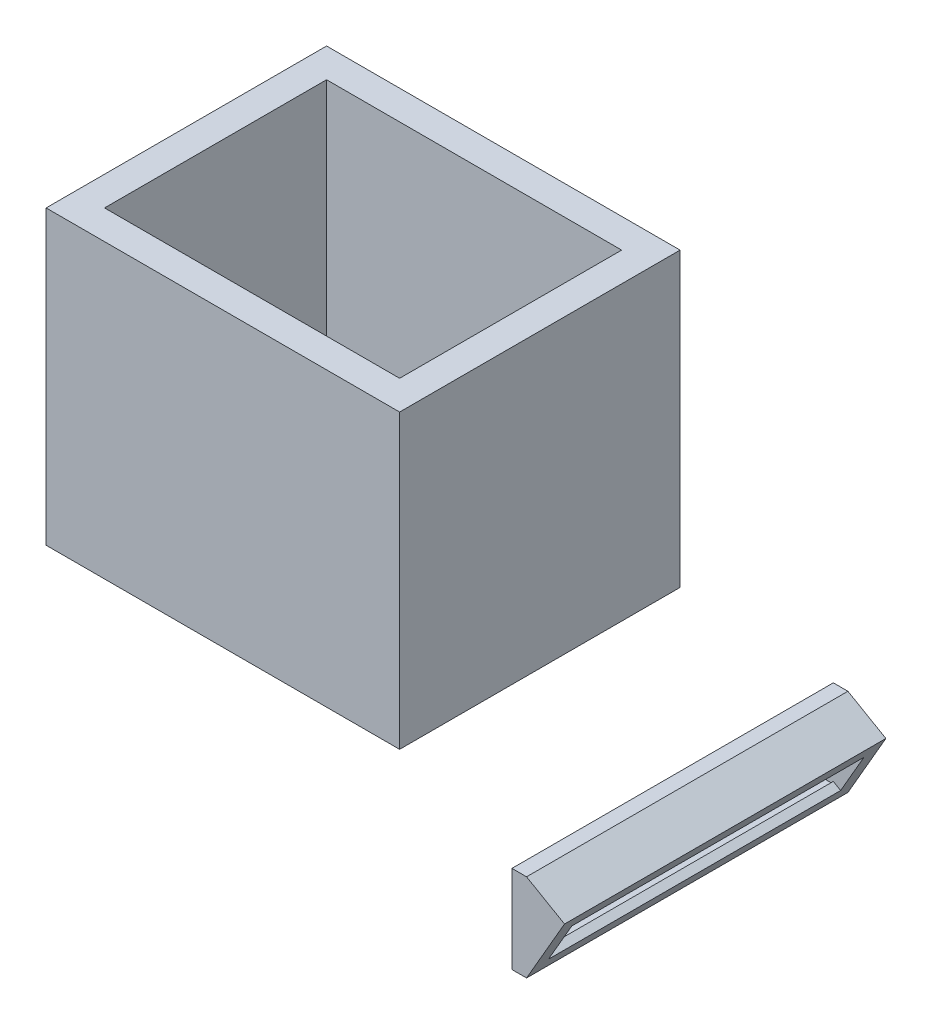
from build123d import *

# Parameters (mm, degrees)
SZKIC1_W                      = 24.2
SZKIC1_H                      = 19.2
SZKIC1_W_2                    = 20.2
SZKIC1_H_2                    = 15.2
DODANIE_WYCI_GNI_CIE1_DEPTH   = 20
SZKIC2_W                      = 22
SZKIC2_H                      = 6
SZKIC2_W_2                    = 20
SZKIC2_H_2                    = 4
DODANIE_WYCI_GNI_CIE2_DEPTH   = 1
DODANIE_WYCI_GNI_CIE3_START   = -29.189963439
DODANIE_WYCI_GNI_CIE3_DEPTH   = 22
DODANIE_WYCI_GNI_CIE3_2_DEPTH = 1
DODANIE_WYCI_GNI_CIE3_START_2 = -8.189963439
DODANIE_WYCI_GNI_CIE3_3_DEPTH = 1


# Read off the part's stored shape, not the designer's step: Dodanie-wyciągnięcie3
with BuildPart() as part:
    # Szkic1 → Dodanie-wyciągnięcie1 (new body)
    with BuildSketch(Plane(origin=(0, 0, 0), x_dir=(1, 0, 0), z_dir=(0, 1, 0))):
        Rectangle(SZKIC1_W, SZKIC1_H)
        Rectangle(SZKIC1_W_2, SZKIC1_H_2, mode=Mode.SUBTRACT)
    extrude(amount=DODANIE_WYCI_GNI_CIE1_DEPTH)


with BuildPart() as body_2:
    # Szkic2 → Dodanie-wyciągnięcie2 (new body)
    with BuildSketch(Plane(origin=(3, 0, 0), x_dir=(0, 0, -1), z_dir=(1, 0, 0))):
        with Locations((18.189963439, -23)):
            Rectangle(SZKIC2_W, SZKIC2_H)
        with Locations((18.189963439, -23)):
            Rectangle(SZKIC2_W_2, SZKIC2_H_2, mode=Mode.SUBTRACT)
    extrude(amount=DODANIE_WYCI_GNI_CIE2_DEPTH)

    # Dodanie-wyciągnięcie3 outline → Dodanie-wyciągnięcie3 (add)
    with BuildSketch(Plane.XY.offset(DODANIE_WYCI_GNI_CIE3_START)):
        Polygon((4.5, -25.133974596), (4, -24.845299462), (4, -26), align=None)
        Polygon((4, -20), (4, -21.154700538), (6.098076211, -22.366025404), (6.598076211, -21.5), align=None)
    extrude(amount=DODANIE_WYCI_GNI_CIE3_DEPTH)

    # Dodanie-wyci_gni_cie3 2 outline → Dodanie-wyci_gni_cie3 2 (add)
    with BuildSketch(Plane.XY.offset(DODANIE_WYCI_GNI_CIE3_START)):
        Polygon((4, -21.154700538), (4, -24.845299462), (4.5, -25.133974596), (6.098076211, -22.366025404), align=None)
    extrude(amount=DODANIE_WYCI_GNI_CIE3_2_DEPTH)

    # Dodanie-wyci_gni_cie3 3 outline → Dodanie-wyci_gni_cie3 3 (add)
    with BuildSketch(Plane.XY.offset(DODANIE_WYCI_GNI_CIE3_START_2)):
        Polygon((4, -21.154700538), (4, -24.845299462), (4.5, -25.133974596), (6.098076211, -22.366025404), align=None)
    extrude(amount=DODANIE_WYCI_GNI_CIE3_3_DEPTH)


solid = Compound([part.part, body_2.part])
